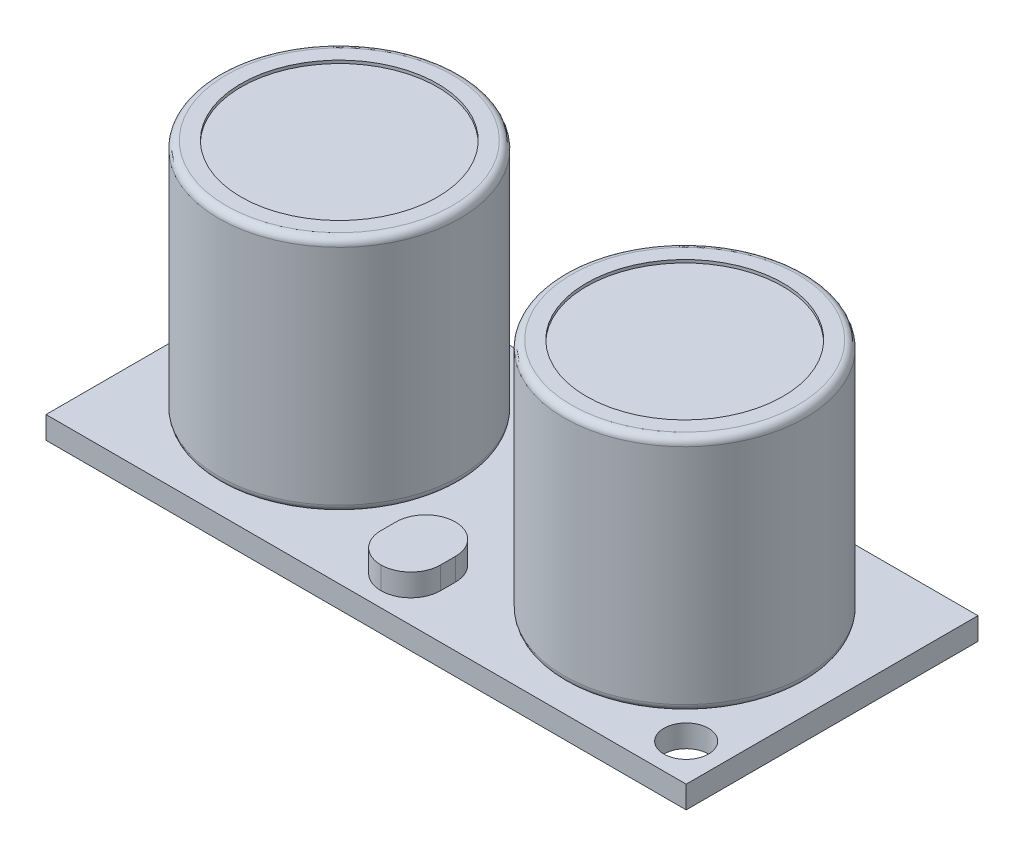
from build123d import *

# Parameters (mm, degrees)
SKETCH1_R          = 8.1
EXTRUDE1_DEPTH     = 16
EXTRUDE1_2_DEPTH   = 16
FILLET1_R          = 0.5
SKETCH2_R          = 6.6
CUT_EXTRUDE2_DEPTH = 0.2
FILLET2_R          = 0.5
SKETCH3_W          = 43
SKETCH3_H          = 19.6
SKETCH3_R          = 1.5
EXTRUDE2_DEPTH     = 1.5
SKETCH4_W          = 2
SKETCH4_H          = 5
EXTRUDE3_DEPTH     = 1.5
FILLET3_R          = 2


with BuildPart() as part:
    # Sketch1 → Extrude1 (new body)
    with BuildSketch(Plane(origin=(0, 0, 0), x_dir=(1, 0, 0), z_dir=(0, 1, 0))):
        with Locations(Location((0, 0, 0), (0, 0, 270))):
            Circle(SKETCH1_R)
    extrude(amount=EXTRUDE1_DEPTH)

    # Fillet1
    fillet1_edges = [part.edges().sort_by_distance(p)[0] for p in [
        (0, 0, -8.1),
        (0, 16, -8.1),
    ]]
    fillet(fillet1_edges, radius=FILLET1_R)


with BuildPart() as body_2:
    # Sketch1 → Extrude1 2 (new body)
    with BuildSketch(Plane(origin=(0, 0, 0), x_dir=(1, 0, 0), z_dir=(0, 1, 0))):
        with Locations(Location((23.2, 0, 0), (0, 0, 270))):
            Circle(SKETCH1_R)
    extrude(amount=EXTRUDE1_2_DEPTH)


with BuildPart() as cut_extrude2_tool:
    # Sketch2 → Cut-Extrude2 (new body)
    with BuildSketch(Plane(origin=(0, 16, 0), x_dir=(-1, 0, 0), z_dir=(0, 1, 0))):
        with Locations(Location((-23.2, 0, 0), (0, 0, 90))):
            Circle(SKETCH2_R)
        with Locations(Location((0, 0, 0), (0, 0, 90))):
            Circle(SKETCH2_R)
    extrude(amount=-CUT_EXTRUDE2_DEPTH)


with BuildPart() as part_1:
    add(part.part)

    # Cut-Extrude2: cut by cut_extrude2_tool
    add(cut_extrude2_tool.part, mode=Mode.SUBTRACT)



with BuildPart() as body_2_1:
    add(body_2.part)

    # Cut-Extrude2: cut by cut_extrude2_tool
    add(cut_extrude2_tool.part, mode=Mode.SUBTRACT)

    # Fillet2
    fillet2_edges = [body_2_1.edges().sort_by_distance(p)[0] for p in [
        (23.2, 0, -8.1),
        (23.2, 16, -8.1),
    ]]
    fillet(fillet2_edges, radius=FILLET2_R)


with BuildPart() as part_2:
    add(part_1.part)

    add(body_2_1.part)  # Extrude2 merges body 2
    # Sketch3 → Extrude2 (add)
    with BuildSketch(Plane.XZ):
        with Locations((11.6, 0)):
            Rectangle(SKETCH3_W, SKETCH3_H)
        with Locations(Location((-7.4, -7.3, 0), (0, 0, 270))):
            Circle(SKETCH3_R, mode=Mode.SUBTRACT)
        with Locations(Location((30.6, 7.3, 0), (0, 0, 270))):
            Circle(SKETCH3_R, mode=Mode.SUBTRACT)
    extrude(amount=EXTRUDE2_DEPTH)

    # Sketch4 → Extrude3 (add)
    with BuildSketch(Plane(origin=(0, 0, 0), x_dir=(-1, 0, 0), z_dir=(0, 1, 0))):
        with Locations((-10.6, 6.3)):
            Rectangle(SKETCH4_W, SKETCH4_H)
        with Locations((-12.6, 6.3)):
            Rectangle(SKETCH4_W, SKETCH4_H)
    extrude(amount=EXTRUDE3_DEPTH)

    # Fillet3
    fillet3_edges = [part_2.edges().sort_by_distance(p)[0] for p in [
        (9.6, 0.75, 3.8),
        (13.6, 0.75, 3.8),
        (9.6, 0.75, 8.8),
        (13.6, 0.75, 8.8),
    ]]
    fillet(fillet3_edges, radius=FILLET3_R - 0.0001)  # a hair under: the kernel refuses the full size


solid = part_2.part
